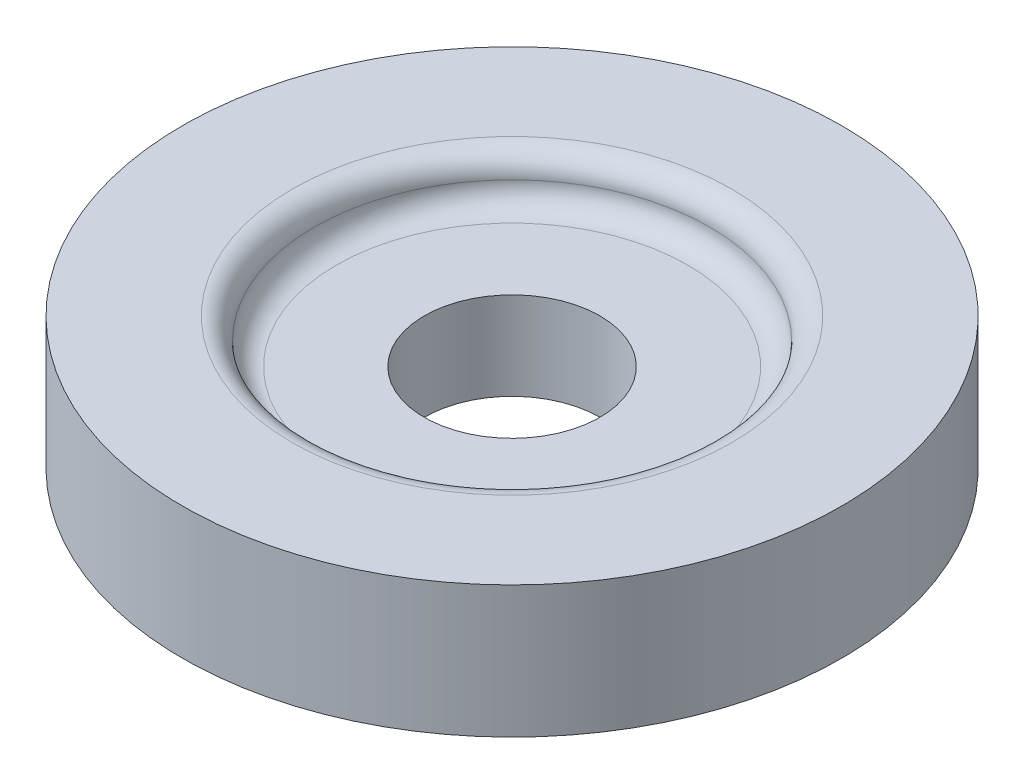
from build123d import *

# Parameters (mm, degrees)
FILLET_1_R = 0.5


with BuildPart() as part:
    # 草图2 → 旋转1 (revolve)
    with BuildSketch(Plane.XY, mode=Mode.PRIVATE) as revolve_1_sk:
        Polygon((2, 0), (7.5, 0), (7.5, 3), (4.5, 3), (4.5, 2), (2, 2), align=None)
    revolve(revolve_1_sk.sketch.rotate(Axis((0, 0, 0), (0, 1, 0)), 90), axis=Axis((0, 0, 0), (0, 1, 0)))

    # 圆角1
    fillet_1_edges = [part.edges().sort_by_distance(p)[0] for p in [
        (0, 2, 4.5),
        (0, 3, 4.5),
    ]]
    fillet(fillet_1_edges, radius=FILLET_1_R - 0.0001)  # a hair under: the kernel refuses the full size


solid = part.part
